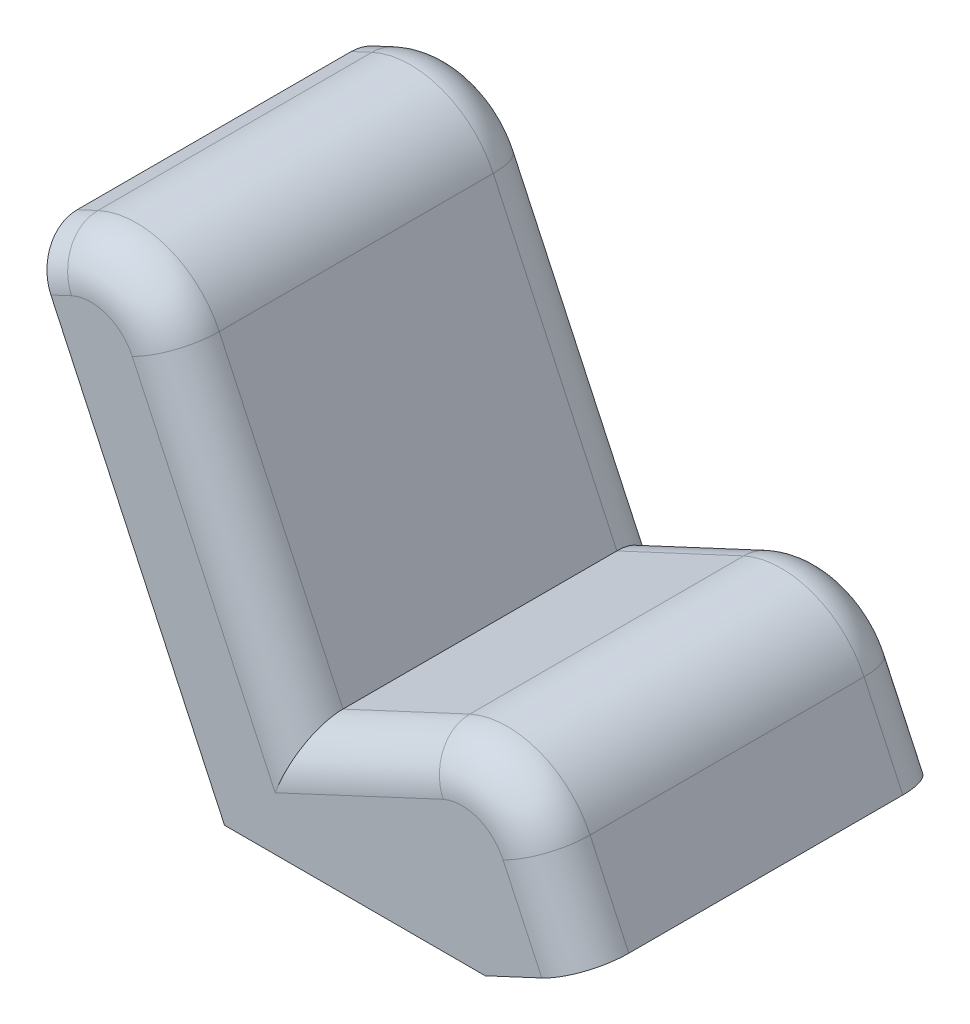
from build123d import *

# Parameters (mm, degrees)
BOSS_EXTRUDE1_DEPTH = 40
SKETCH2_R           = 7.5
BOSS_EXTRUDE2_DEPTH = 5
FILLET1_R           = 10


with BuildPart() as part:
    # Sketch1 → Boss-Extrude1 (new, symmetric)
    with BuildSketch(Plane.XY):
        with BuildLine():
            Line((-42.261826174, 90.630778704), (0, 0))
            Line((0, 0), (57.1, 0))
            Line((57.1, 0), (78.545069205, 10))
            Line((78.545069205, 10), (70.06731645, 28.180599453))
            ThreePointArc((70.06731645, 28.180599453), (58.907926391, 38.47561206), (43.733601964, 37.96654498))
            Line((43.733601964, 37.96654498), (15.92675652, 25))
            Line((15.92675652, 25), (-11.151766263, 83.070079506))
            ThreePointArc((-11.151766263, 83.070079506), (-22.437519138, 93.411566687), (-37.730287239, 92.743870012))
            Line((-37.730287239, 92.743870012), (-42.261826174, 90.630778704))
        make_face()
    extrude(amount=BOSS_EXTRUDE1_DEPTH, both=True)

    # Sketch2 → Boss-Extrude2 (add, symmetric)
    with BuildSketch(Plane.XZ):
        with Locations(Location((30, 0, 0), (0, 0, 90))):
            Circle(SKETCH2_R)
    extrude(amount=BOSS_EXTRUDE2_DEPTH, both=True)

    # Fillet1
    # the kernel refuses this fillet: 10 mm, written as the material it takes off along each edge
    with BuildSketch(Plane(origin=(43.733601964, 37.96654498, -40), x_dir=(0.42261826174070133, -0.9063077870366492, 0), z_dir=(-0.9063077870366492, -0.4226182617407013, 0))) as fillet1_piece_1:
        with BuildLine():
            CenterArc((FILLET1_R, FILLET1_R), FILLET1_R, 180, 90)
            Line((0, FILLET1_R), (0, 0))
            Line((0, 0), (FILLET1_R, 0))
        make_face()
    extrude(amount=30.681459259, mode=Mode.SUBTRACT)
    with BuildSketch(Plane(origin=(51.94116071, 19.728234218, -40), x_dir=(0.9063077870366498, 0.42261826174069983, 0), z_dir=(0.42261826174069983, -0.9063077870366498, 0))) as fillet1_piece_2:
        with BuildLine():
            CenterArc((20 - FILLET1_R, FILLET1_R), FILLET1_R, 270, 90)
            Line((20, FILLET1_R), (20, 0))
            Line((20, 0), (20 - FILLET1_R, 0))
        make_face()
    revolve(axis=Axis((51.94116071, 19.728234218, -40), (0, 0, 1)), revolution_arc=89.228578439, mode=Mode.SUBTRACT)
    with BuildSketch(Plane(origin=(89.110525749, -12.657694676, -40), x_dir=(-0.90630778703665, -0.4226182617406995, 0), z_dir=(-0.42261826174069944, 0.9063077870366499, 0))) as fillet1_piece_3:
        with BuildLine():
            CenterArc((FILLET1_R, FILLET1_R), FILLET1_R, 180, 90)
            Line((0, FILLET1_R), (0, 0))
            Line((0, 0), (FILLET1_R, 0))
        make_face()
    extrude(amount=45.06007199, mode=Mode.SUBTRACT)
    with BuildSketch(Plane(origin=(-37.730287239, 92.743870012, -40), x_dir=(0.4226182617406985, -0.9063077870366504, 0), z_dir=(-0.9063077870366504, -0.42261826174069855, 0))) as fillet1_piece_4:
        with BuildLine():
            CenterArc((FILLET1_R, FILLET1_R), FILLET1_R, 180, 90)
            Line((0, FILLET1_R), (0, 0))
            Line((0, 0), (FILLET1_R, 0))
        make_face()
    extrude(amount=30, mode=Mode.SUBTRACT)
    with BuildSketch(Plane(origin=(89.110525749, -12.657694676, 40), x_dir=(-0.90630778703665, -0.4226182617406995, 0), z_dir=(-0.42261826174069944, 0.9063077870366499, 0))) as fillet1_piece_5:
        with BuildLine():
            CenterArc((FILLET1_R, -FILLET1_R), FILLET1_R, 90, 90)
            Line((0, -FILLET1_R), (0, 0))
            Line((0, 0), (FILLET1_R, 0))
        make_face()
    extrude(amount=45.06007199, mode=Mode.SUBTRACT)
    with BuildSketch(Plane(origin=(51.94116071, 19.728234218, 40), x_dir=(0.9063077870366498, 0.42261826174069983, 0), z_dir=(0.42261826174069983, -0.9063077870366498, 0))) as fillet1_piece_6:
        with BuildLine():
            CenterArc((20 - FILLET1_R, -FILLET1_R), FILLET1_R, 0, 90)
            Line((20, -FILLET1_R), (20, 0))
            Line((20, 0), (20 - FILLET1_R, 0))
        make_face()
    revolve(axis=Axis((51.94116071, 19.728234218, 40), (0, 0, 1)), revolution_arc=89.228578439, mode=Mode.SUBTRACT)
    with BuildSketch(Plane(origin=(43.733601964, 37.96654498, 40), x_dir=(0.42261826174070133, -0.9063077870366492, 0), z_dir=(-0.9063077870366492, -0.4226182617407013, 0))) as fillet1_piece_7:
        with BuildLine():
            CenterArc((FILLET1_R, -FILLET1_R), FILLET1_R, 90, 90)
            Line((0, -FILLET1_R), (0, 0))
            Line((0, 0), (FILLET1_R, 0))
        make_face()
    extrude(amount=30.681459259, mode=Mode.SUBTRACT)
    with BuildSketch(Plane(origin=(15.92675652, 25, 40), x_dir=(-0.9063077870366495, -0.42261826174070066, 0), z_dir=(-0.42261826174070066, 0.9063077870366494, 0))) as fillet1_piece_8:
        with BuildLine():
            CenterArc((FILLET1_R, -FILLET1_R), FILLET1_R, 90, 90)
            Line((0, -FILLET1_R), (0, 0))
            Line((0, 0), (FILLET1_R, 0))
        make_face()
    extrude(amount=64.07324348, mode=Mode.SUBTRACT)
    with BuildSketch(Plane(origin=(-29.277922004, 74.617714272, 40), x_dir=(0.9063077870366488, 0.4226182617407019, 0), z_dir=(0.4226182617407019, -0.9063077870366488, 0))) as fillet1_piece_9:
        with BuildLine():
            CenterArc((20 - FILLET1_R, -FILLET1_R), FILLET1_R, 0, 90)
            Line((20, -FILLET1_R), (20, 0))
            Line((20, 0), (20 - FILLET1_R, 0))
        make_face()
    revolve(axis=Axis((-29.277922004, 74.617714272, 40), (0, 0, 1)), revolution_arc=90, mode=Mode.SUBTRACT)
    with BuildSketch(Plane(origin=(-37.730287239, 92.743870012, 40), x_dir=(0.4226182617406985, -0.9063077870366504, 0), z_dir=(-0.9063077870366504, -0.42261826174069855, 0))) as fillet1_piece_10:
        with BuildLine():
            CenterArc((FILLET1_R, -FILLET1_R), FILLET1_R, 90, 90)
            Line((0, -FILLET1_R), (0, 0))
            Line((0, 0), (FILLET1_R, 0))
        make_face()
    extrude(amount=30, mode=Mode.SUBTRACT)
    with BuildSketch(Plane(origin=(-29.277922004, 74.617714272, -40), x_dir=(0.9063077870366488, 0.4226182617407019, 0), z_dir=(0.4226182617407019, -0.9063077870366488, 0))) as fillet1_piece_11:
        with BuildLine():
            CenterArc((20 - FILLET1_R, FILLET1_R), FILLET1_R, 270, 90)
            Line((20, FILLET1_R), (20, 0))
            Line((20, 0), (20 - FILLET1_R, 0))
        make_face()
    revolve(axis=Axis((-29.277922004, 74.617714272, -40), (0, 0, 1)), revolution_arc=90, mode=Mode.SUBTRACT)
    with BuildSketch(Plane(origin=(15.92675652, 25, -40), x_dir=(-0.9063077870366495, -0.42261826174070066, 0), z_dir=(-0.42261826174070066, 0.9063077870366494, 0))) as fillet1_piece_12:
        with BuildLine():
            CenterArc((FILLET1_R, FILLET1_R), FILLET1_R, 180, 90)
            Line((0, FILLET1_R), (0, 0))
            Line((0, 0), (FILLET1_R, 0))
        make_face()
    extrude(amount=64.07324348, mode=Mode.SUBTRACT)
    with BuildSketch(Plane(origin=(43.733601964, 37.96654498, -40), x_dir=(0.42261826174070133, -0.9063077870366492, 0), z_dir=(-0.9063077870366492, -0.4226182617407013, 0))) as fillet1_piece_13a_section:
        with BuildLine():
            CenterArc((FILLET1_R, FILLET1_R), FILLET1_R, 180, 90)
            Line((0, FILLET1_R), (0, 0))
            Line((0, 0), (FILLET1_R, 0))
        make_face()
    fillet1_piece_13a = extrude(amount=55.681459259, mode=Mode.PRIVATE)
    fillet1_piece_13a = split(fillet1_piece_13a, bisect_by=Plane(origin=(16.883543617, 22.94816345, -37.736048857), z_dir=(-0.9063077870366494, -0.42261826174070066, 0)), keep=Keep.TOP, mode=Mode.PRIVATE)
    with BuildSketch(Plane(origin=(26.492213064, 2.342305324, -40), x_dir=(-0.9063077870366495, -0.42261826174070066, 0), z_dir=(-0.42261826174070066, 0.9063077870366494, 0))) as fillet1_piece_13b_section:
        with BuildLine():
            CenterArc((FILLET1_R, FILLET1_R), FILLET1_R, 180, 90)
            Line((0, FILLET1_R), (0, 0))
            Line((0, 0), (FILLET1_R, 0))
        make_face()
    fillet1_piece_13b = extrude(amount=89.07324348, mode=Mode.PRIVATE)
    fillet1_piece_13b = split(fillet1_piece_13b, bisect_by=Plane(origin=(13.87491997, 24.043212903, -37.736048857), z_dir=(0.4226182617407013, -0.9063077870366492, 0)), keep=Keep.TOP, mode=Mode.PRIVATE)
    fillet1_piece_13 = fillet1_piece_13a & fillet1_piece_13b
    add(fillet1_piece_13, mode=Mode.SUBTRACT)
    with BuildSketch(Plane(origin=(43.733601964, 37.96654498, 40), x_dir=(0.42261826174070133, -0.9063077870366492, 0), z_dir=(-0.9063077870366492, -0.4226182617407013, 0))) as fillet1_piece_14a_section:
        with BuildLine():
            CenterArc((FILLET1_R, -FILLET1_R), FILLET1_R, 90, 90)
            Line((0, -FILLET1_R), (0, 0))
            Line((0, 0), (FILLET1_R, 0))
        make_face()
    fillet1_piece_14a = extrude(amount=55.681459259, mode=Mode.PRIVATE)
    fillet1_piece_14a = split(fillet1_piece_14a, bisect_by=Plane(origin=(16.883543617, 22.94816345, 37.736048857), z_dir=(-0.9063077870366494, -0.42261826174070066, 0)), keep=Keep.TOP, mode=Mode.PRIVATE)
    with BuildSketch(Plane(origin=(26.492213064, 2.342305324, 40), x_dir=(-0.9063077870366495, -0.42261826174070066, 0), z_dir=(-0.42261826174070066, 0.9063077870366494, 0))) as fillet1_piece_14b_section:
        with BuildLine():
            CenterArc((FILLET1_R, -FILLET1_R), FILLET1_R, 90, 90)
            Line((0, -FILLET1_R), (0, 0))
            Line((0, 0), (FILLET1_R, 0))
        make_face()
    fillet1_piece_14b = extrude(amount=89.07324348, mode=Mode.PRIVATE)
    fillet1_piece_14b = split(fillet1_piece_14b, bisect_by=Plane(origin=(13.87491997, 24.043212903, 37.736048857), z_dir=(0.4226182617407013, -0.9063077870366492, 0)), keep=Keep.TOP, mode=Mode.PRIVATE)
    fillet1_piece_14 = fillet1_piece_14a & fillet1_piece_14b
    add(fillet1_piece_14, mode=Mode.SUBTRACT)


solid = part.part
